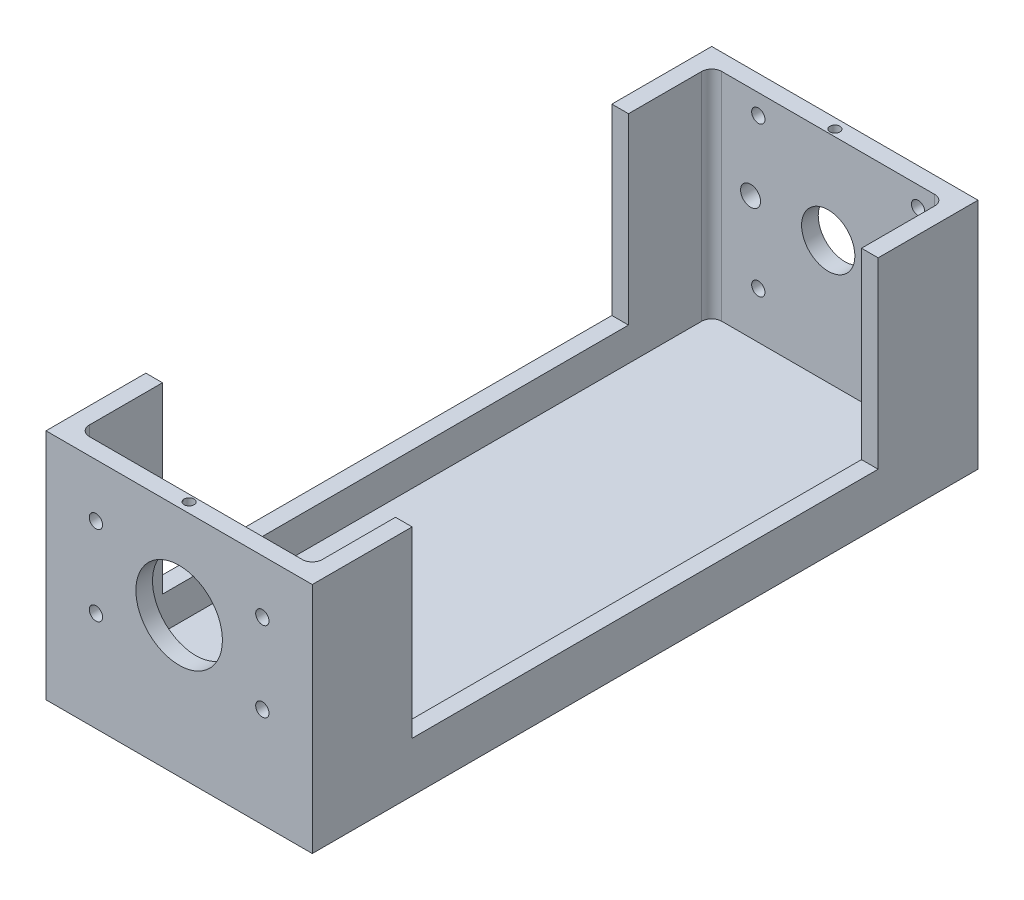
from build123d import *

# Parameters (mm, degrees)
SKETCH_1_W           = 80
SKETCH_1_H           = 70
EXTRUDE_1_DEPTH      = 200
CUT_EXTRUDE_1_DEPTH  = 65
SKETCH_3_R           = 13
CUT_EXTRUDE_2_DEPTH  = 10
SKETCH_4_R           = 2
SKETCH_4_W           = 27
SKETCH_4_H           = 36
CUT_EXTRUDE_3_DEPTH  = 10
SKETCH_7_R           = 1.5
CUT_EXTRUDE_6_DEPTH  = 10
SKETCH_8_W           = 140
SKETCH_8_H           = 55
CUT_EXTRUDE_7_DEPTH  = 219.231528428
SKETCH_9_R           = 2
CUT_EXTRUDE_8_DEPTH  = 6
SKETCH_10_R          = 8
CUT_EXTRUDE_9_DEPTH  = 10
SKETCH_11_R          = 2
SKETCH_11_R_2        = 3
CUT_EXTRUDE_10_DEPTH = 6


with BuildPart() as part:
    # 草图1 → 凸台-拉伸1 (new body)
    with BuildSketch(Plane.XY):
        Rectangle(SKETCH_1_W, SKETCH_1_H)
    extrude(amount=-EXTRUDE_1_DEPTH)

    # 草图2 → 切除-拉伸1 (cut)
    with BuildSketch(Plane(origin=(0, 35, 0), x_dir=(1, 0, 0), z_dir=(0, 1, 0))):
        with BuildLine():
            ThreePointArc((-32, 195), (-34.121320344, 194.121320344), (-35, 192))
            Line((-35, 192), (-35, 8))
            ThreePointArc((-35, 8), (-34.121320344, 5.878679656), (-32, 5))
            Line((-32, 5), (32, 5))
            ThreePointArc((32, 5), (34.121320344, 5.878679656), (35, 8))
            Line((35, 8), (35, 192))
            ThreePointArc((35, 192), (34.121320344, 194.121320344), (32, 195))
            Line((32, 195), (-32, 195))
        make_face()
    extrude(amount=-CUT_EXTRUDE_1_DEPTH, mode=Mode.SUBTRACT)

    # 草图3 → 切除-拉伸2 (cut)
    with BuildSketch(Plane.XY):
        with Locations((0, 7)):
            Circle(SKETCH_3_R)
    extrude(amount=-CUT_EXTRUDE_2_DEPTH, mode=Mode.SUBTRACT)

    # 草图4 → 切除-拉伸3 (cut)
    with BuildSketch(Plane.ZY.offset(40)):
        with Locations((-121.5, 2)):
            Circle(SKETCH_4_R)
        with Locations((-121.5, 26)):
            Circle(SKETCH_4_R)
        with Locations((-158.5, 26)):
            Circle(SKETCH_4_R)
        with Locations((-158.5, 2)):
            Circle(SKETCH_4_R)
        with Locations((-140, 14)):
            Rectangle(SKETCH_4_W, SKETCH_4_H)
    extrude(amount=-CUT_EXTRUDE_3_DEPTH, mode=Mode.SUBTRACT)

    # 草图7 → 切除-拉伸6 (cut)
    with BuildSketch(Plane(origin=(0, 35, 0), x_dir=(1, 0, 0), z_dir=(0, 1, 0))):
        with Locations((-37, 150)):
            Circle(SKETCH_7_R)
        with Locations((-37, 50)):
            Circle(SKETCH_7_R)
        with Locations((37, 50)):
            Circle(SKETCH_7_R)
        with Locations((37, 150)):
            Circle(SKETCH_7_R)
        with Locations((0, 197)):
            Circle(SKETCH_7_R)
        with Locations((0, 3)):
            Circle(SKETCH_7_R)
    extrude(amount=-CUT_EXTRUDE_6_DEPTH, mode=Mode.SUBTRACT)

    # 草图8 → 切除-拉伸7 (cut, through all)
    with BuildSketch(Plane(origin=(40, 0, 0), x_dir=(0, 0, -1), z_dir=(1, 0, 0))):
        with Locations((100, 7.5)):
            Rectangle(SKETCH_8_W, SKETCH_8_H)
    extrude(amount=-CUT_EXTRUDE_7_DEPTH, mode=Mode.SUBTRACT)

    # 草图9 → 切除-拉伸8 (cut)
    with BuildSketch(Plane(origin=(0, 0, -5), x_dir=(-1, 0, 0), z_dir=(0, 0, -1))):
        with Locations((-25, -5)):
            Circle(SKETCH_9_R)
        with Locations((-25, 19)):
            Circle(SKETCH_9_R)
        with Locations((25, 19)):
            Circle(SKETCH_9_R)
        with Locations((25, -5)):
            Circle(SKETCH_9_R)
    extrude(amount=-CUT_EXTRUDE_8_DEPTH, mode=Mode.SUBTRACT)

    # 草图10 → 切除-拉伸9 (cut)
    with BuildSketch(Plane(origin=(0, 0, -200), x_dir=(-1, 0, 0), z_dir=(0, 0, -1))):
        with Locations((0, 7)):
            Circle(SKETCH_10_R)
    extrude(amount=-CUT_EXTRUDE_9_DEPTH, mode=Mode.SUBTRACT)

    # 草图11 → 切除-拉伸10 (cut)
    with BuildSketch(Plane.XY.offset(-195)):
        with Locations((-21, 29)):
            Circle(SKETCH_11_R)
        with Locations((-21, -16)):
            Circle(SKETCH_11_R)
        with Locations((-23.328121258, 7)):
            Circle(SKETCH_11_R_2)
        with Locations((27, 29)):
            Circle(SKETCH_11_R)
        with Locations((24.671878742, 7)):
            Circle(SKETCH_11_R_2)
        with Locations((27, -16)):
            Circle(SKETCH_11_R)
    extrude(amount=-CUT_EXTRUDE_10_DEPTH, mode=Mode.SUBTRACT)


solid = part.part
